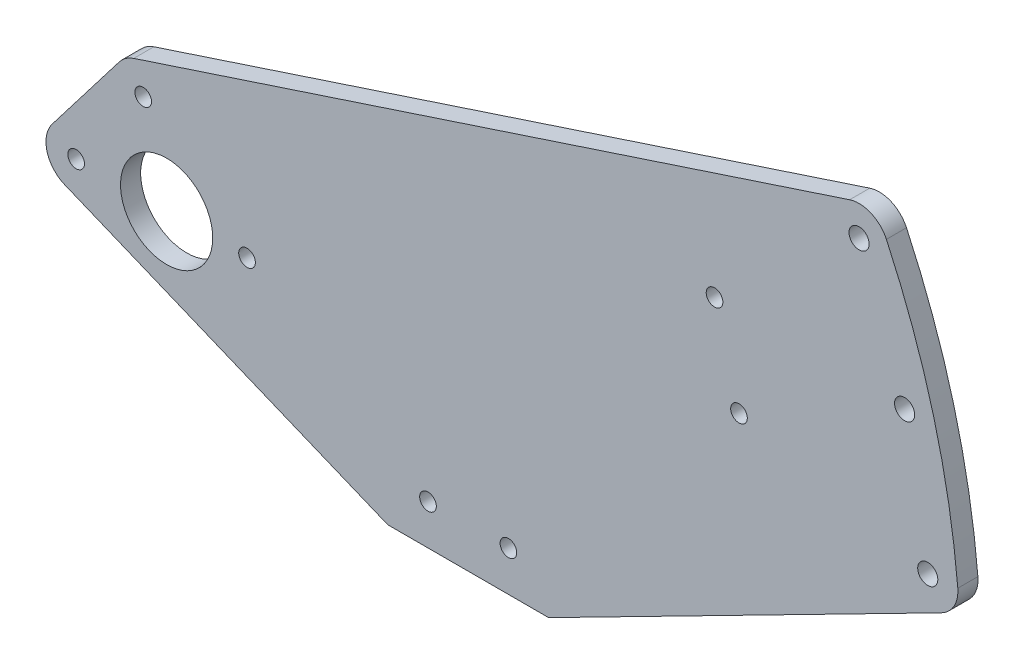
from build123d import *

# Parameters (mm, degrees)
SKETCH1_R           = 14.5542
SKETCH1_R_2         = 2.6289
SKETCH1_R_3         = 3.175
BOSS_EXTRUDE1_DEPTH = 6.35


with BuildPart() as part:
    # Sketch1 → Boss-Extrude1 (new body)
    with BuildSketch(Plane.XY):
        with BuildLine():
            Line((-36.131690566, 5.798452611), (-14.95244478, 33.399783098))
            ThreePointArc((-14.95244478, 33.399783098), (-12.907289703, 35.369766722), (-10.372281426, 36.649308755))
            Line((-10.372281426, 36.649308755), (215.715541799, 111.025764827))
            ThreePointArc((215.715541799, 111.025764827), (222.474160144, 110.71972065), (227.324650683, 106.003225501))
            ThreePointArc((227.324650683, 106.003225501), (242.278345379, 64.918286988), (249.870535149, 21.860839175))
            ThreePointArc((249.870535149, 21.860839175), (248.714513601, 16.416443349), (244.713320148, 12.547556856))
            Line((244.713320148, 12.547556856), (120.65, -50.8))
            Line((120.65, -50.8), (69.85, -50.8))
            Line((69.85, -50.8), (-32.199514598, -8.808434533))
            ThreePointArc((-32.199514598, -8.808434533), (-37.772560831, -2.475984603), (-36.131690566, 5.798452611))
        make_face()
        Circle(SKETCH1_R, mode=Mode.SUBTRACT)
        with Locations((-28.575, 0)):
            Circle(SKETCH1_R_2, mode=Mode.SUBTRACT)
        with Locations((-7.395754214, 27.601330486)):
            Circle(SKETCH1_R_2, mode=Mode.SUBTRACT)
        with Locations((240.38178065, 21.030680725)):
            Circle(SKETCH1_R_3, mode=Mode.SUBTRACT)
        with Locations((233.077901884, 62.453035583)):
            Circle(SKETCH1_R_3, mode=Mode.SUBTRACT)
        with Locations((218.692069012, 101.977786558)):
            Circle(SKETCH1_R_3, mode=Mode.SUBTRACT)
        with Locations((82.55, -38.1)):
            Circle(SKETCH1_R_2, mode=Mode.SUBTRACT)
        with Locations((107.95, -38.1)):
            Circle(SKETCH1_R_2, mode=Mode.SUBTRACT)
        with Locations((25.4, 0)):
            Circle(SKETCH1_R_2, mode=Mode.SUBTRACT)
        with Locations((173.044396118, 62.983009393)):
            Circle(SKETCH1_R_2, mode=Mode.SUBTRACT)
        with Locations((180.766645832, 35.137476499)):
            Circle(SKETCH1_R_2, mode=Mode.SUBTRACT)
    extrude(amount=BOSS_EXTRUDE1_DEPTH)


solid = part.part
